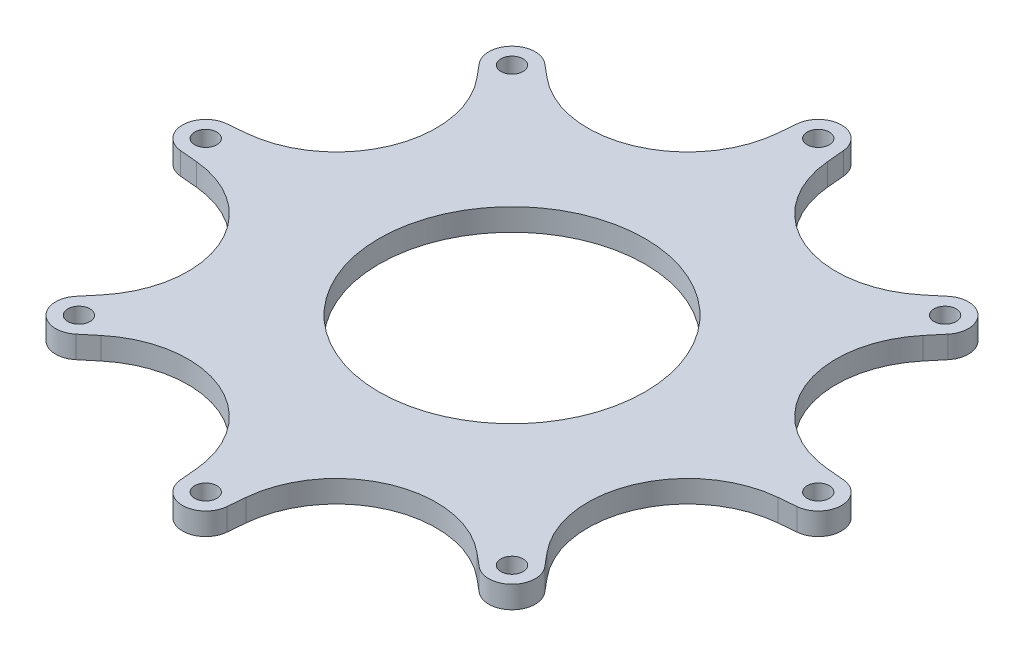
from build123d import *

# Parameters (mm, degrees)
BOSS_EXTRUDE1_DEPTH = 5
SKETCH2_R           = 2.5
CUT_EXTRUDE1_DEPTH  = 10
SKETCH3_R           = 30
CUT_EXTRUDE2_DEPTH  = 10


with BuildPart() as part:
    # Sketch1 → Boss-Extrude1 (new body)
    with BuildSketch(Plane(origin=(0, 0, 0), x_dir=(1, 0, 0), z_dir=(0, 1, 0))):
        with BuildLine():
            Line((65.565343666, -5.592001639), (69.572261498, -5.228532951))
            ThreePointArc((69.572261498, -5.228532951), (74.347979746, 0), (69.572261498, 5.228532951))
            Line((69.572261498, 5.228532951), (65.565343666, 5.592001639))
            ThreePointArc((65.565343666, 5.592001639), (46.810690265, 19.389622772), (50.315841396, 42.407556838))
            Line((50.315841396, 42.407556838), (52.892148993, 45.497886783))
            ThreePointArc((52.892148993, 45.497886783), (52.571960646, 52.571960646), (45.497886783, 52.892148993))
            Line((45.497886783, 52.892148993), (42.407556838, 50.315841396))
            ThreePointArc((42.407556838, 50.315841396), (19.389622772, 46.810690265), (5.592001639, 65.565343666))
            Line((5.592001639, 65.565343666), (5.228532951, 69.572261498))
            ThreePointArc((5.228532951, 69.572261498), (0, 74.347979746), (-5.228532951, 69.572261498))
            Line((-5.228532951, 69.572261498), (-5.592001639, 65.565343666))
            ThreePointArc((-5.592001639, 65.565343666), (-19.389622772, 46.810690265), (-42.407556838, 50.315841396))
            Line((-42.407556838, 50.315841396), (-45.497886783, 52.892148993))
            ThreePointArc((-45.497886783, 52.892148993), (-52.571960646, 52.571960646), (-52.892148993, 45.497886783))
            Line((-52.892148993, 45.497886783), (-50.315841396, 42.407556838))
            ThreePointArc((-50.315841396, 42.407556838), (-46.810690265, 19.389622772), (-65.565343666, 5.592001639))
            Line((-65.565343666, 5.592001639), (-69.572261498, 5.228532951))
            ThreePointArc((-69.572261498, 5.228532951), (-74.347979746, 0), (-69.572261498, -5.228532951))
            Line((-69.572261498, -5.228532951), (-65.565343666, -5.592001639))
            ThreePointArc((-65.565343666, -5.592001639), (-46.810690265, -19.389622772), (-50.315841396, -42.407556838))
            Line((-50.315841396, -42.407556838), (-52.892148993, -45.497886783))
            ThreePointArc((-52.892148993, -45.497886783), (-52.571960646, -52.571960646), (-45.497886783, -52.892148993))
            Line((-45.497886783, -52.892148993), (-42.407556838, -50.315841396))
            ThreePointArc((-42.407556838, -50.315841396), (-19.389622772, -46.810690265), (-5.592001639, -65.565343666))
            Line((-5.592001639, -65.565343666), (-5.228532951, -69.572261498))
            ThreePointArc((-5.228532951, -69.572261498), (0, -74.347979746), (5.228532951, -69.572261498))
            Line((5.228532951, -69.572261498), (5.592001639, -65.565343666))
            ThreePointArc((5.592001639, -65.565343666), (19.389622772, -46.810690265), (42.407556838, -50.315841396))
            Line((42.407556838, -50.315841396), (45.497886783, -52.892148993))
            ThreePointArc((45.497886783, -52.892148993), (52.571960646, -52.571960646), (52.892148993, -45.497886783))
            Line((52.892148993, -45.497886783), (50.315841396, -42.407556838))
            ThreePointArc((50.315841396, -42.407556838), (46.810690265, -19.389622772), (65.565343666, -5.592001639))
        make_face()
    extrude(amount=BOSS_EXTRUDE1_DEPTH)

    # Sketch2 → Cut-Extrude1 (cut)
    with BuildSketch(Plane(origin=(0, 5, 0), x_dir=(1, 0, 0), z_dir=(0, 1, 0))):
        with Locations((69.097979746, 0)):
            Circle(SKETCH2_R)
        with Locations((48.859650045, -48.859650045)):
            Circle(SKETCH2_R)
        with Locations((0, -69.097979746)):
            Circle(SKETCH2_R)
        with Locations((-48.859650045, -48.859650045)):
            Circle(SKETCH2_R)
        with Locations((-69.097979746, 0)):
            Circle(SKETCH2_R)
        with Locations((-48.859650045, 48.859650045)):
            Circle(SKETCH2_R)
        with Locations((0, 69.097979746)):
            Circle(SKETCH2_R)
        with Locations((48.859650045, 48.859650045)):
            Circle(SKETCH2_R)
    extrude(amount=-CUT_EXTRUDE1_DEPTH, mode=Mode.SUBTRACT)

    # Sketch3 → Cut-Extrude2 (cut)
    with BuildSketch(Plane(origin=(0, 5, 0), x_dir=(1, 0, 0), z_dir=(0, 1, 0))):
        Circle(SKETCH3_R)
    extrude(amount=-CUT_EXTRUDE2_DEPTH, mode=Mode.SUBTRACT)


solid = part.part
